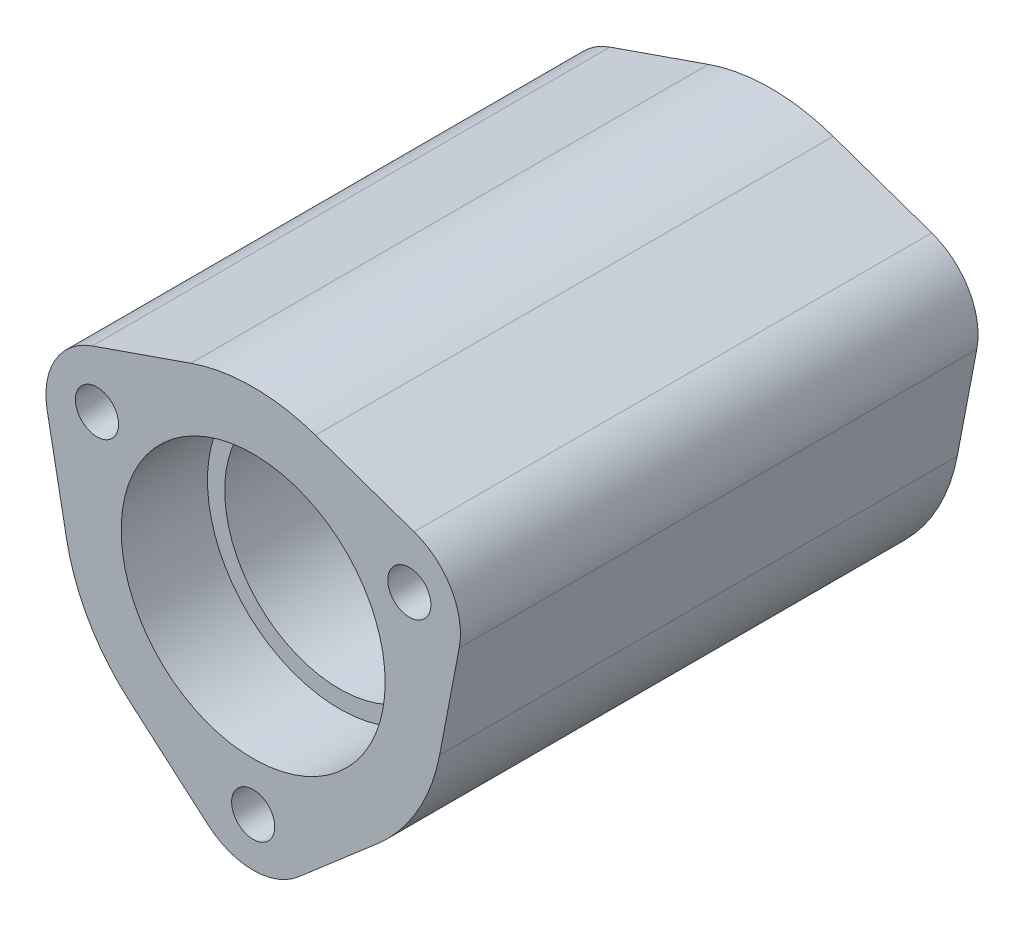
from build123d import *

# Parameters (mm, degrees)
EXTRUDE_760_DEPTH      = 15
EXTRUDE_760_DEPTH_BACK = 15
SKETCH_2_R             = 7.65
CUT_EXTRUDE_1098_DEPTH = 5
SKETCH_3_R             = 6.65
CUT_EXTRUDE_1240_DEPTH = 31.737928604
SKETCH_4_R             = 1.25
CUT_EXTRUDE_1731_DEPTH = 35.925925254


with BuildPart() as part:
    # Эскиз1 → Extrude 760 (new, two sides: drawn at the far end of the back side and taken through both)
    with BuildSketch(Plane.XY.offset(-EXTRUDE_760_DEPTH_BACK)):
        with BuildLine():
            Line((-9.32482414, 8.402984872), (-3.613745176, 10.389458398))
            ThreePointArc((-3.613745176, 10.389458398), (0, 11), (3.613745176, 10.389458398))
            Line((3.613745176, 10.389458398), (9.32482414, 8.402984872))
            ThreePointArc((9.32482414, 8.402984872), (11.4748366, 6.625), (11.939610437, 3.874042155))
            Line((11.939610437, 3.874042155), (10.804407492, -2.065134074))
            ThreePointArc((10.804407492, -2.065134074), (9.526279442, -5.5), (7.190662316, -8.324324324))
            Line((7.190662316, -8.324324324), (2.614786297, -12.277027027))
            ThreePointArc((2.614786297, -12.277027027), (0, -13.25), (-2.614786297, -12.277027027))
            Line((-2.614786297, -12.277027027), (-7.190662316, -8.324324324))
            ThreePointArc((-7.190662316, -8.324324324), (-9.526279442, -5.5), (-10.804407492, -2.065134074))
            Line((-10.804407492, -2.065134074), (-11.939610437, 3.874042155))
            ThreePointArc((-11.939610437, 3.874042155), (-11.4748366, 6.625), (-9.32482414, 8.402984872))
        make_face()
    extrude(amount=EXTRUDE_760_DEPTH + EXTRUDE_760_DEPTH_BACK)

    # Эскиз2 → Cut-Extrude 1098 (cut)
    with BuildSketch(Plane.XY.offset(15)):
        Circle(SKETCH_2_R)
    cut_extrude_1098 = extrude(amount=-CUT_EXTRUDE_1098_DEPTH, mode=Mode.SUBTRACT)

    # Mirror 1140: Cut-Extrude 1098 across plane
    add(cut_extrude_1098.mirror(Plane.XY), mode=Mode.SUBTRACT)

    # Эскиз3 → Cut-Extrude 1240 (cut, through all)
    with BuildSketch(Plane.XY.offset(10)):
        Circle(SKETCH_3_R)
    extrude(amount=-CUT_EXTRUDE_1240_DEPTH, mode=Mode.SUBTRACT)

    # Эскиз4 → Cut-Extrude 1731 (cut, through all)
    with BuildSketch(Plane.XY.offset(15)):
        with Locations((-9.04996547, 5.225)):
            Circle(SKETCH_4_R)
        with Locations((0, -10.45)):
            Circle(SKETCH_4_R)
        with Locations((9.04996547, 5.225)):
            Circle(SKETCH_4_R)
    extrude(amount=-CUT_EXTRUDE_1731_DEPTH, mode=Mode.SUBTRACT)


solid = part.part
